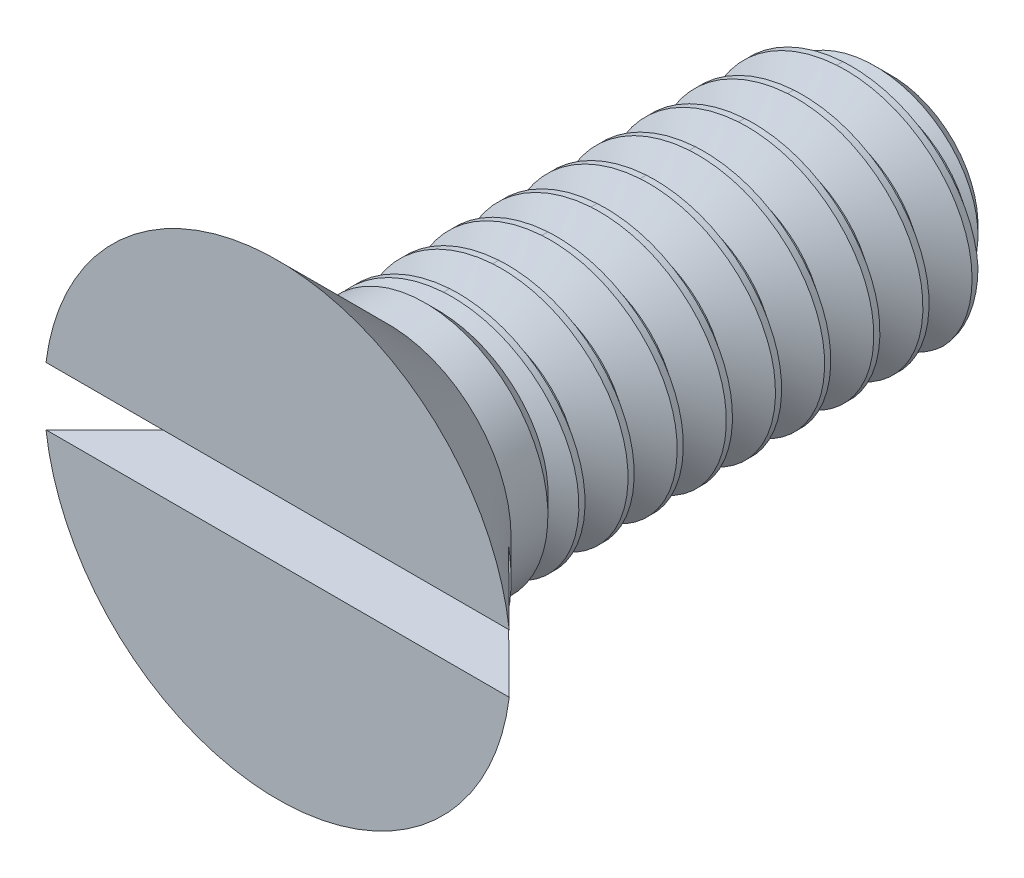
from build123d import *
from build123d.topology import SkipClean

# Parameters (mm, degrees)
SKETCH1_R        = 1.9
EXTRUDE3_DEPTH   = 1.2
SKETCH4_W        = 5
SKETCH4_H        = 1
CUT_SWEEP1_PITCH = 0.4
SKETCH26_R       = 0.5
EXTRUDE8_DEPTH   = 1.2
SKETCH12_W       = 3.8
SKETCH12_H       = 0.475
EXTRUDE12_DEPTH  = 0.6


with BuildPart() as part:
    # Sketch1 → Extrude3 (new body)
    with BuildSketch(Plane.XY):
        Circle(SKETCH1_R)
    extrude(amount=EXTRUDE3_DEPTH)

    # Sketch11 → Cut-Revolve3 (revolve, cut)
    with BuildSketch(Plane(origin=(0, 0, 0), x_dir=(0, 0, -1), z_dir=(1, 0, 0)), mode=Mode.PRIVATE) as cut_revolve3_sk:
        Polygon((0, 0.7), (-1.2, 1.9), (0, 1.9), align=None)
    revolve(cut_revolve3_sk.sketch.rotate(Axis((0, 0, -0.441444004), (0, 0, 1)), 90), axis=Axis((0, 0, -0.441444004), (0, 0, 1)), mode=Mode.SUBTRACT)

    # Extrude10: read off the stored shape, not the designer's step
    # Extrude10 outline → Extrude10 (revolve)
    with BuildSketch(Plane.XZ):
        Polygon((1, 0), (1, 0.3), (0.7, 0.3), (0.7, 0), (0, 0), (0, -1), align=None)
    revolve(axis=Axis((0, 0, 0), (0, 0, 1)))



with BuildPart() as body_2:
    # Sketch4 → Revolve1 (revolve)
    with BuildSketch(Plane(origin=(0, 0, 0), x_dir=(0, 0, -1), z_dir=(1, 0, 0)), mode=Mode.PRIVATE) as revolve1_sk:
        with Locations((1.3, 0.5)):
            Rectangle(SKETCH4_W, SKETCH4_H)
    revolve(revolve1_sk.sketch.rotate(Axis((0, 0, 1.2), (0, 0, -1)), 180), axis=Axis((0, 0, 1.2), (0, 0, -1)))

    # Cut-Sweep1: arcs per turn and ends read off the stored shape
    # Cut-Sweep1: the profile of Sketch14 profile screwed along a right-hand helix through 12.5 turns, 6 arcs to a turn; built about Z, then put on its axis
    cut_sweep1_z = Axis((0, 0, 0), (0, 0, 1))
    cut_sweep1_corners = [(1.0003, 0, -0.299833707), (1.0003, 0, -0.650166293), (0.729392837, 0, -0.5), (0.729392837, 0, -0.45)]
    with BuildLine(mode=Mode.PRIVATE) as cut_sweep1_profile:
        Line(cut_sweep1_corners[0], cut_sweep1_corners[1])
        Line(cut_sweep1_corners[1], cut_sweep1_corners[2])
        Line(cut_sweep1_corners[2], cut_sweep1_corners[3])
        Line(cut_sweep1_corners[3], cut_sweep1_corners[0])
    cut_sweep1_cap = Face(cut_sweep1_profile.wire())
    cut_sweep1_turn_angles = [0, 30, 60, 90, 120, 150, 180, 210, 240, 270, 300, 330, 360]
    cut_sweep1_turn_weights = [1, 0.8660254037844387, 1, 0.8660254037844387, 1, 0.8660254037844387, 1, 0.8660254037844387, 1, 0.8660254037844387, 1, 0.8660254037844387, 1]
    cut_sweep1_turn_rails = [Edge.make_bspline([Vector(p[0], p[1], 0).rotate(cut_sweep1_z, cut_sweep1_turn_angles[k]) / cut_sweep1_turn_weights[k] + Vector(0, 0, p[2] + CUT_SWEEP1_PITCH * cut_sweep1_turn_angles[k] / 360) for k in range(13)], [0, 0, 0, 1, 1, 2, 2, 3, 3, 4, 4, 5, 5, 6, 6, 6], 2, cut_sweep1_turn_weights) for p in cut_sweep1_corners]
    cut_sweep1_turn_sides = [Face.make_surface_from_curves(cut_sweep1_turn_rails[p[0]], cut_sweep1_turn_rails[p[1]]) for p in [(0, 1), (1, 2), (2, 3), (3, 0)]]
    cut_sweep1_last_angles = [4320, 4350, 4380, 4410, 4440, 4470, 4500]
    cut_sweep1_last_weights = [1, 0.8660254037844387, 1, 0.8660254037844387, 1, 0.8660254037843236, 1]
    cut_sweep1_last_rails = [Edge.make_bspline([Vector(p[0], p[1], 0).rotate(cut_sweep1_z, cut_sweep1_last_angles[k]) / cut_sweep1_last_weights[k] + Vector(0, 0, p[2] + CUT_SWEEP1_PITCH * cut_sweep1_last_angles[k] / 360) for k in range(7)], [0, 0, 0, 1, 1, 2, 2, 3, 3, 3], 2, cut_sweep1_last_weights) for p in cut_sweep1_corners]
    cut_sweep1_last_sides = [Face.make_surface_from_curves(cut_sweep1_last_rails[p[0]], cut_sweep1_last_rails[p[1]]) for p in [(0, 1), (1, 2), (2, 3), (3, 0)]]
    cut_sweep1 = Plane(origin=(0, 0, -3.8), x_dir=(-1, 0, 0), z_dir=(0, 0, 1)) * Solid(Shell([*[p.moved(Location((0, 0, CUT_SWEEP1_PITCH * i))) for i in range(12) for p in cut_sweep1_turn_sides], *cut_sweep1_last_sides, cut_sweep1_cap, cut_sweep1_cap.rotate(cut_sweep1_z, 4500).moved(Location((0, 0, CUT_SWEEP1_PITCH * 4500 / 360)))]))
    add(cut_sweep1, mode=Mode.SUBTRACT)

    # Sketch19 → Cut-Revolve4 (revolve, cut)
    with BuildSketch(Plane(origin=(0, 0, 0), x_dir=(0, 0, -1), z_dir=(1, 0, 0)), mode=Mode.PRIVATE) as cut_revolve4_sk:
        Polygon((3.8, 1), (3.5, 1), (3.8, 0.7), align=None)
    revolve(cut_revolve4_sk.sketch.rotate(Axis((0, 0, 1.2), (0, 0, -1)), 180), axis=Axis((0, 0, 1.2), (0, 0, -1)), mode=Mode.SUBTRACT)


with BuildPart() as part_1:
    with SkipClean():  # the faces are left unmerged after this step: merging them gives an invalid solid
        add(part.part)

        add(body_2.part)  # Extrude8 merges body 2
        # Sketch26 → Extrude8 (add)
        with BuildSketch(Plane.XY.offset(1.2)):
            Circle(SKETCH26_R)
        extrude(amount=-EXTRUDE8_DEPTH)

    # Sketch12 → Extrude12 (cut)
    with BuildSketch(Plane.XY.offset(1.2)):
        Rectangle(SKETCH12_W, SKETCH12_H)
    extrude(amount=-EXTRUDE12_DEPTH, mode=Mode.SUBTRACT)


solid = part_1.part
